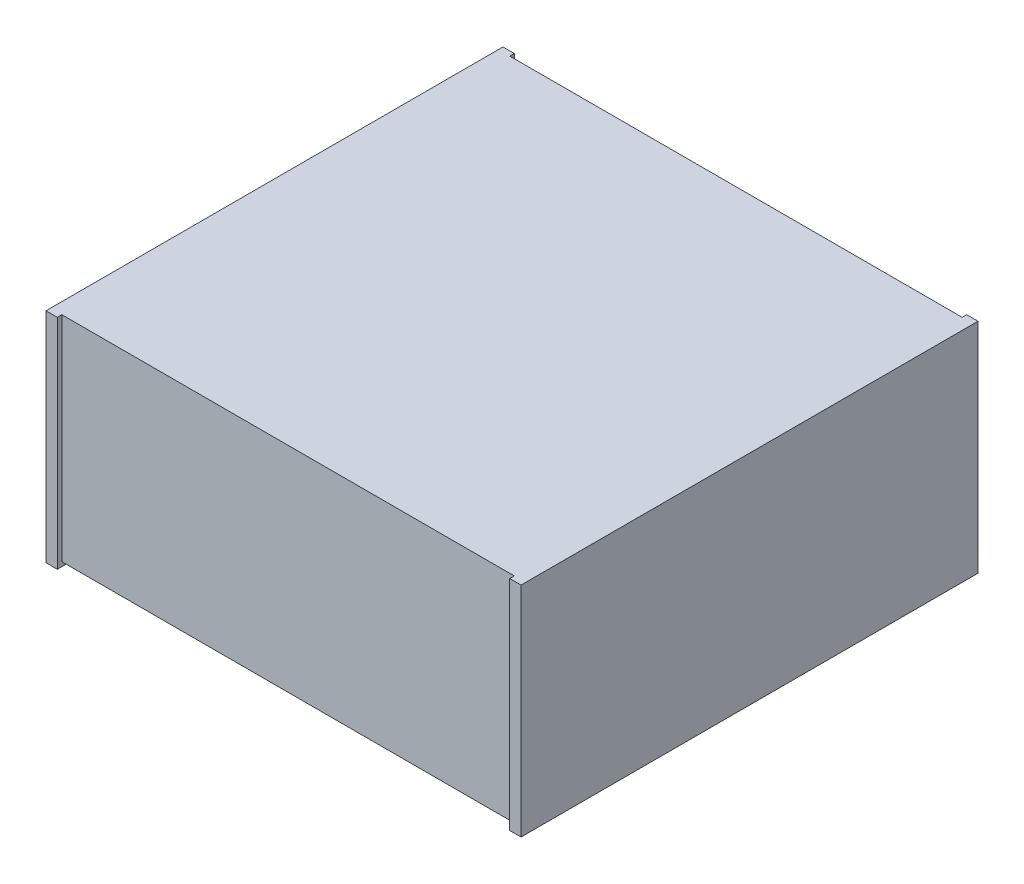
from build123d import *

# Parameters (mm, degrees)
BOSS_EXTRUDE1_DEPTH = 2000
SKETCH2_W           = 143.807096291
SKETCH2_H           = 56.765959062
BOSS_EXTRUDE2_DEPTH = 50
SKETCH3_W           = 50
SKETCH3_H           = 143.807096291
BOSS_EXTRUDE3_DEPTH = 19.145261779
SKETCH4_W           = 2050
SKETCH4_H           = 143.807096291
BOSS_EXTRUDE4_DEPTH = 888.8375165
SKETCH5_W           = 143.807096291
SKETCH5_H           = 945.603475562
BOSS_EXTRUDE5_DEPTH = 50
SKETCH6_W           = 50
SKETCH6_H           = 143.807096291
BOSS_EXTRUDE6_DEPTH = 19.145261779
BOSS_EXTRUDE7_DEPTH = 1856.192903709
SKETCH8_W           = 50
SKETCH8_H           = 964.748737342
BOSS_EXTRUDE8_DEPTH = 20
SKETCH9_W           = 50
SKETCH9_H           = 964.748737342
BOSS_EXTRUDE9_DEPTH = 20
SKETCH10_W          = 2000
SKETCH10_H          = 1456.444166367
CUT_EXTRUDE1_DEPTH  = 683.8375165
SKETCH11_W          = 2000
SKETCH11_H          = 20
CUT_EXTRUDE2_DEPTH  = 200
RIB1_REACH          = 4461.071
SKETCH12_WALL_W     = 10920.142474856
SKETCH12_WALL_H     = 53.033008588
RIB2_START          = -26.516504294
RIB2_OUTLINE_W      = 998.266278858
RIB2_OUTLINE_H      = 610.630552395
RIB2_DEPTH          = 53.033008588
RIB3_START          = -26.516504294
RIB3_OUTLINE_W      = 1000
RIB3_OUTLINE_H      = 610.630552395
RIB3_DEPTH          = 53.033008589
RIB4_START          = -26.516504294
RIB4_OUTLINE_W      = 998.844185905
RIB4_OUTLINE_H      = 610.630552395
RIB4_DEPTH          = 53.033008588
RIB5_START          = -26.516504294
RIB5_OUTLINE_W      = 1000
RIB5_OUTLINE_H      = 610.630552395
RIB5_DEPTH          = 53.033008588
RIB6_START          = -26.516504294
RIB6_OUTLINE_W      = 999.422092953
RIB6_OUTLINE_H      = 610.630552395
RIB6_DEPTH          = 53.033008588
RIB7_START          = -26.516504294
RIB7_OUTLINE_W      = 1000
RIB7_OUTLINE_H      = 610.630552395
RIB7_DEPTH          = 53.033008588


# Read off the part's stored shape, not the designer's step: Rib2, Rib3, Rib4, Rib5, Rib6, Rib7
with BuildPart() as part:
    # Sketch1 → Boss-Extrude1 (new body)
    with BuildSketch(Plane(origin=(4100, 0, 0), x_dir=(0, 0, -1), z_dir=(1, 0, 0))):
        Polygon((-1856.192903709, -888.8375165), (-2000, -888.8375165), (-2000, -945.603475562), align=None)
    extrude(amount=-BOSS_EXTRUDE1_DEPTH)

    # Sketch2 → Boss-Extrude2 (add)
    with BuildSketch(Plane.ZY.offset(-2100)):
        with Locations((1928.096451855, -917.220496031)):
            Rectangle(SKETCH2_W, SKETCH2_H)
    extrude(amount=BOSS_EXTRUDE2_DEPTH)

    # Sketch3 → Boss-Extrude3 (add)
    with BuildSketch(Plane.XZ.offset(945.603475562)):
        with Locations((2075, 1928.096451855)):
            Rectangle(SKETCH3_W, SKETCH3_H)
    extrude(amount=BOSS_EXTRUDE3_DEPTH)

    # Sketch4 → Boss-Extrude4 (add)
    with BuildSketch(Plane(origin=(0, -888.8375165, 0), x_dir=(-1, 0, 0), z_dir=(0, 1, 0))):
        with Locations((-3075, 1928.096451855)):
            Rectangle(SKETCH4_W, SKETCH4_H)
    extrude(amount=BOSS_EXTRUDE4_DEPTH)

    # Sketch5 → Boss-Extrude5 (add)
    with BuildSketch(Plane(origin=(4100, 0, 0), x_dir=(0, 0, -1), z_dir=(1, 0, 0))):
        with Locations((-1928.096451855, -472.801737781)):
            Rectangle(SKETCH5_W, SKETCH5_H)
    extrude(amount=BOSS_EXTRUDE5_DEPTH)

    # Sketch6 → Boss-Extrude6 (add)
    with BuildSketch(Plane.XZ.offset(945.603475562)):
        with Locations((4125, 1928.096451855)):
            Rectangle(SKETCH6_W, SKETCH6_H)
    extrude(amount=BOSS_EXTRUDE6_DEPTH)

    # Sketch7 → Boss-Extrude7 (add)
    with BuildSketch(Plane(origin=(0, 0, 1856.192903709), x_dir=(-1, 0, 0), z_dir=(0, 0, -1))):
        Polygon((-2050, 0), (-2050, -964.748737342), (-2100, -964.748737342), (-2100, -883.8375165), (-4100, -883.8375165), (-4100, -964.748737342), (-4150, -964.748737342), (-4150, 0), align=None)
    extrude(amount=BOSS_EXTRUDE7_DEPTH)

    # Sketch8 → Boss-Extrude8 (add)
    with BuildSketch(Plane.XY.offset(2000)):
        with Locations((2075, -482.374368671)):
            Rectangle(SKETCH8_W, SKETCH8_H)
    extrude(amount=BOSS_EXTRUDE8_DEPTH)

    # Sketch9 → Boss-Extrude9 (add)
    with BuildSketch(Plane.XY.offset(2000)):
        with Locations((4125, -482.374368671)):
            Rectangle(SKETCH9_W, SKETCH9_H)
    extrude(amount=BOSS_EXTRUDE9_DEPTH)

    # Sketch10 → Cut-Extrude1 (cut)
    with BuildSketch(Plane.XZ.offset(883.8375165)):
        with Locations((3100, 1127.970820526)):
            Rectangle(SKETCH10_W, SKETCH10_H)
    extrude(amount=-CUT_EXTRUDE1_DEPTH, mode=Mode.SUBTRACT)

    # Sketch11 → Cut-Extrude2 (cut)
    with BuildSketch(Plane(origin=(0, 0, 0), x_dir=(-1, 0, 0), z_dir=(0, 1, 0))):
        with Locations((-3100, 10)):
            Rectangle(SKETCH11_W, SKETCH11_H)
    extrude(amount=-CUT_EXTRUDE2_DEPTH, mode=Mode.SUBTRACT)

    # Sketch12 wall → Rib1 (add, up to next)
    with BuildSketch(Plane(origin=(3100, -810.630552395, 704.676399414), x_dir=(1, 0, 0), z_dir=(0, 1, 0)), mode=Mode.PRIVATE) as rib1_sk1:
        Rectangle(SKETCH12_WALL_W, SKETCH12_WALL_H)
    rib1_tool1 = extrude(rib1_sk1.sketch, amount=RIB1_REACH, mode=Mode.PRIVATE) - part.part
    add(rib1_tool1.solids().sort_by_distance((3100, -810.630552395, 704.676399414))[0])

    # Rib2 outline → Rib2 (add)
    with BuildSketch(Plane.XY.offset(1604.672929526).offset(RIB2_START)):
        with Locations((3600.866860571, -505.315276197)):
            Rectangle(RIB2_OUTLINE_W, RIB2_OUTLINE_H)
    extrude(amount=RIB2_DEPTH)

    # Rib3 outline → Rib3 (add)
    with BuildSketch(Plane.XY.offset(1604.674599414).offset(RIB3_START)):
        with Locations((2600, -505.315276197)):
            Rectangle(RIB3_OUTLINE_W, RIB3_OUTLINE_H)
    extrude(amount=RIB3_DEPTH)

    # Rib4 outline → Rib4 (add)
    with BuildSketch(Plane.XY.offset(1304.674086156).offset(RIB4_START)):
        with Locations((3600.577907048, -505.315276197)):
            Rectangle(RIB4_OUTLINE_W, RIB4_OUTLINE_H)
    extrude(amount=RIB4_DEPTH)

    # Rib5 outline → Rib5 (add)
    with BuildSketch(Plane.XY.offset(1004.675799414).offset(RIB5_START)):
        with Locations((2600, -505.315276197)):
            Rectangle(RIB5_OUTLINE_W, RIB5_OUTLINE_H)
    extrude(amount=RIB5_DEPTH)

    # Rib6 outline → Rib6 (add)
    with BuildSketch(Plane.XY.offset(1004.675799414).offset(RIB6_START)):
        with Locations((3600.288953523, -505.315276197)):
            Rectangle(RIB6_OUTLINE_W, RIB6_OUTLINE_H)
    extrude(amount=RIB6_DEPTH)

    # Rib7 outline → Rib7 (add)
    with BuildSketch(Plane.XY.offset(1304.675199414).offset(RIB7_START)):
        with Locations((2600, -505.315276197)):
            Rectangle(RIB7_OUTLINE_W, RIB7_OUTLINE_H)
    extrude(amount=RIB7_DEPTH)


solid = part.part
